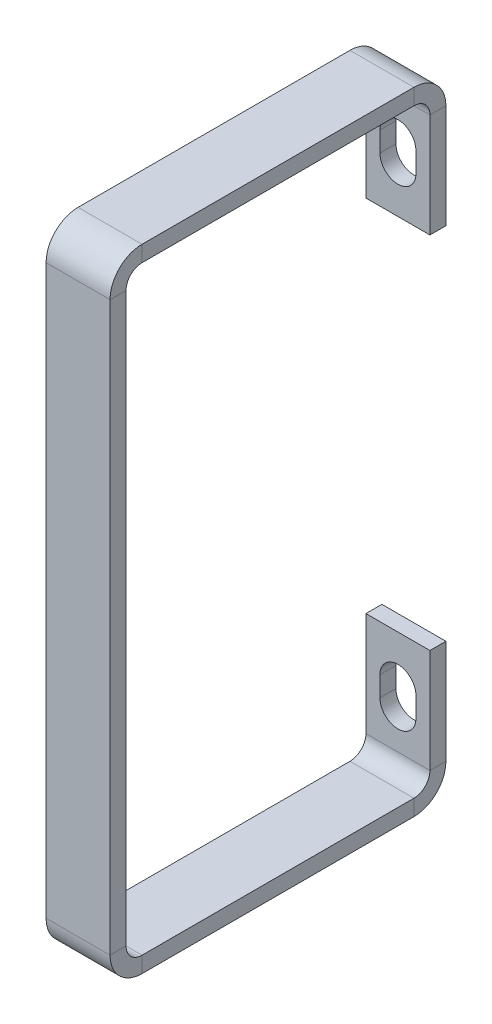
from build123d import *

# Parameters (mm, degrees)
SKIZZE1_W                       = 8
SKIZZE1_H                       = 75
BASIS_BLECH1_DEPTH              = 2
KANTE_LASCHE3_STRIP_W           = 12
KANTE_LASCHE3_STRIP_H           = 2
KANTE_LASCHE3_STRIP_CUT_DEPTH   = 8
KANTE_LASCHE3_DEPTH             = 8
KANTE_LASCHE4_STRIP_W           = 12
KANTE_LASCHE4_STRIP_H           = 2
KANTE_LASCHE4_STRIP_CUT_DEPTH   = 8
KANTE_LASCHE4_DEPTH             = 8
SCHNITT_LINEAR_AUSTRAGEN1_DEPTH = 2


# Sheet-metal steps are written as plain solids
with BuildPart() as part:
    # Skizze1 → Basis-Blech1 (new body)
    with BuildSketch(Plane.XY):
        with Locations((4, 37.5)):
            Rectangle(SKIZZE1_W, SKIZZE1_H)
    extrude(amount=-BASIS_BLECH1_DEPTH)

    # Kante-Lasche3 strip (across the edge) → Kante-Lasche3 strip cut (cut)
    with BuildSketch(Plane(origin=(0, 75, -2), x_dir=(0, -1, 0), z_dir=(1, 0, 0))):
        with Locations((-4, -1)):
            Rectangle(KANTE_LASCHE3_STRIP_W, KANTE_LASCHE3_STRIP_H)
    kante_lasche3_strip_cut = extrude(amount=KANTE_LASCHE3_STRIP_CUT_DEPTH, mode=Mode.SUBTRACT)

    # Kante-Lasche3 section (across the edge) → Kante-Lasche3 (add)
    with BuildSketch(Plane(origin=(0, 75, -2), x_dir=(0, -1, 0), z_dir=(1, 0, 0))):
        with BuildLine():
            Line((-2, 2), (-2, 38))
            Line((-2, 38), (0, 38))
            Line((0, 38), (0, 2))
            ThreePointArc((0, 2), (0.585786438, 0.585786438), (2, 0))
            Line((2, 0), (2, -2))
            ThreePointArc((2, -2), (-0.828427125, -0.828427125), (-2, 2))
        make_face()
    kante_lasche3 = extrude(amount=KANTE_LASCHE3_DEPTH)

    # Kante-Lasche4 strip (across the edge) → Kante-Lasche4 strip cut (cut)
    with BuildSketch(Plane(origin=(0, 75, -40), x_dir=(0, 0, 1), z_dir=(1, 0, 0))):
        with Locations((-4, -1)):
            Rectangle(KANTE_LASCHE4_STRIP_W, KANTE_LASCHE4_STRIP_H)
    kante_lasche4_strip_cut = extrude(amount=KANTE_LASCHE4_STRIP_CUT_DEPTH, mode=Mode.SUBTRACT)

    # Kante-Lasche4 section (across the edge) → Kante-Lasche4 (add)
    with BuildSketch(Plane(origin=(0, 75, -40), x_dir=(0, 0, 1), z_dir=(1, 0, 0))):
        with BuildLine():
            Line((-2, 2), (-2, 15))
            Line((-2, 15), (0, 15))
            Line((0, 15), (0, 2))
            ThreePointArc((0, 2), (0.585786438, 0.585786438), (2, 0))
            Line((2, 0), (2, -2))
            ThreePointArc((2, -2), (-0.828427125, -0.828427125), (-2, 2))
        make_face()
    kante_lasche4 = extrude(amount=KANTE_LASCHE4_DEPTH)

    # Skizze23 → Schnitt-Linear austragen1 (cut)
    with BuildSketch(Plane(origin=(0, 0, -42), x_dir=(-1, 0, 0), z_dir=(0, 0, -1))):
        with BuildLine():
            Line((-6.25, 65.75), (-6.25, 68.25))
            ThreePointArc((-6.25, 68.25), (-4, 70.5), (-1.75, 68.25))
            Line((-1.75, 68.25), (-1.75, 65.75))
            ThreePointArc((-1.75, 65.75), (-4, 63.5), (-6.25, 65.75))
        make_face()
    schnitt_linear_austragen1 = extrude(amount=-SCHNITT_LINEAR_AUSTRAGEN1_DEPTH, mode=Mode.SUBTRACT)

    # Spiegeln1: Kante-Lasche3 strip cut, Kante-Lasche3, Kante-Lasche4 strip cut, Kante-Lasche4, Schnitt-Linear austragen1 across plane
    add(kante_lasche3_strip_cut.mirror(Plane(origin=(0, 37.5, 0), x_dir=(0, 0, 1), z_dir=(0, -1, 0))), mode=Mode.SUBTRACT)
    add(kante_lasche3.mirror(Plane(origin=(0, 37.5, 0), x_dir=(0, 0, 1), z_dir=(0, -1, 0))))
    add(kante_lasche4_strip_cut.mirror(Plane(origin=(0, 37.5, 0), x_dir=(0, 0, 1), z_dir=(0, -1, 0))), mode=Mode.SUBTRACT)
    add(kante_lasche4.mirror(Plane(origin=(0, 37.5, 0), x_dir=(0, 0, 1), z_dir=(0, -1, 0))))
    add(schnitt_linear_austragen1.mirror(Plane(origin=(0, 37.5, 0), x_dir=(0, 0, 1), z_dir=(0, -1, 0))), mode=Mode.SUBTRACT)


solid = part.part
